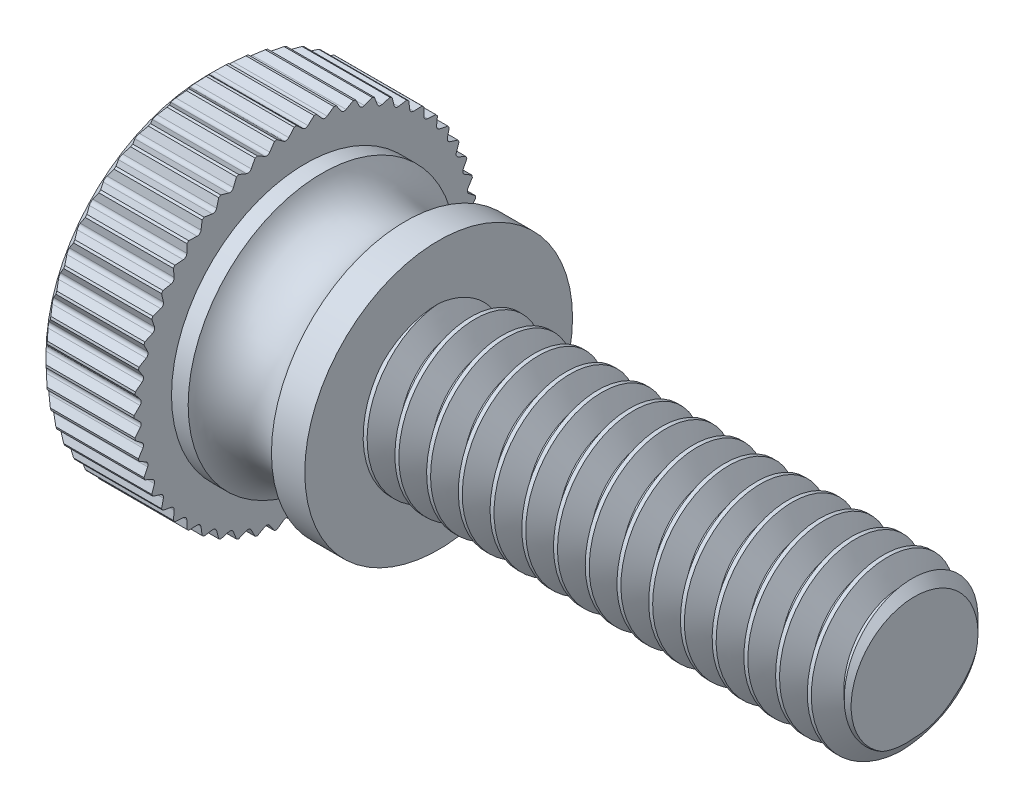
from build123d import *

# Parameters (mm, degrees)
CHAMFER1_SIZE      = 0.635
CHAMFER2_SIZE      = 0.41148
CUT_SWEEP1_PITCH   = 1.27
CUT_SWEEP1_TO      = 19.05
CUT_EXTRUDE1_DEPTH = 9.271
CIRPATTERN1_COUNT  = 54


with BuildPart() as part:
    # Sketch3 → Revolve1 (revolve)
    with BuildSketch(Plane.XY, mode=Mode.PRIVATE) as revolve1_sk:
        with BuildLine():
            Line((-9.271, 0), (-9.271, 6.858))
            Line((-9.271, 6.858), (-5.334, 6.858))
            Line((-5.334, 6.858), (-5.334, 5.3594))
            Line((-5.334, 5.3594), (-4.66725, 5.3594))
            ThreePointArc((-4.66725, 5.3594), (-3.000375, 4.28752), (-1.3335, 5.3594))
            Line((-1.3335, 5.3594), (0, 5.3594))
            Line((0, 5.3594), (0, 3.175))
            Line((0, 3.175), (19.05, 3.175))
            Line((19.05, 3.175), (19.05, 0))
            Line((19.05, 0), (-9.271, 0))
        make_face()
    revolve(revolve1_sk.sketch.rotate(Axis((0, 0, 0), (1, 0, 0)), 90), axis=Axis((0, 0, 0), (1, 0, 0)))

    # Chamfer1
    chamfer1_edges = [part.edges().sort_by_distance(p)[0] for p in [
        (19.05, 0, -3.175),
    ]]
    chamfer(chamfer1_edges, length=CHAMFER1_SIZE)

    # Chamfer2
    chamfer2_edges = [part.edges().sort_by_distance(p)[0] for p in [
        (-9.271, 0, -6.858),
    ]]
    chamfer(chamfer2_edges, length=CHAMFER2_SIZE)


with BuildPart() as body_2:
    # Split1: the piece on the far side of the plane
    add(part.part)
    split(bisect_by=Plane(origin=(0, 0, 0), x_dir=(0, 0, 1), z_dir=(1, 0, 0)), keep=Keep.BOTTOM)


with BuildPart() as part_1:
    add(part.part)

    # Split1
    split(bisect_by=Plane(origin=(0, 0, 0), x_dir=(0, 0, 1), z_dir=(1, 0, 0)), keep=Keep.TOP)

    # Cut-Sweep1: arcs per turn and ends read off the stored shape
    # Cut-Sweep1: the profile of Sketch5 screwed along a right-hand helix through 16 turns, 8 arcs to a turn; built about Z, then put on its axis
    cut_sweep1_z = Axis((0, 0, 0), (0, 0, 1))
    cut_sweep1_corners = [(3.243740766, 0, 0.0396875), (3.243740766, 0, -1.1509375), (2.350110803, 0, -0.635), (2.350110803, 0, -0.47625)]
    with BuildLine(mode=Mode.PRIVATE) as cut_sweep1_profile:
        Line(cut_sweep1_corners[0], cut_sweep1_corners[1])
        Line(cut_sweep1_corners[1], cut_sweep1_corners[2])
        Line(cut_sweep1_corners[2], cut_sweep1_corners[3])
        Line(cut_sweep1_corners[3], cut_sweep1_corners[0])
    cut_sweep1_cap = Face(cut_sweep1_profile.wire())
    cut_sweep1_turn_angles = [0, 22.5, 45, 67.5, 90, 112.5, 135, 157.5, 180, 202.5, 225, 247.5, 270, 292.5, 315, 337.5, 360]
    cut_sweep1_turn_weights = [1, 0.9238795325112867, 1, 0.9238795325112867, 1, 0.9238795325112867, 1, 0.9238795325112867, 1, 0.9238795325112867, 1, 0.9238795325112867, 1, 0.9238795325112867, 1, 0.9238795325112867, 1]
    cut_sweep1_turn_rails = [Edge.make_bspline([Vector(p[0], p[1], 0).rotate(cut_sweep1_z, cut_sweep1_turn_angles[k]) / cut_sweep1_turn_weights[k] + Vector(0, 0, p[2] + CUT_SWEEP1_PITCH * cut_sweep1_turn_angles[k] / 360) for k in range(17)], [0, 0, 0, 1, 1, 2, 2, 3, 3, 4, 4, 5, 5, 6, 6, 7, 7, 8, 8, 8], 2, cut_sweep1_turn_weights) for p in cut_sweep1_corners]
    cut_sweep1_turn_sides = [Face.make_surface_from_curves(cut_sweep1_turn_rails[p[0]], cut_sweep1_turn_rails[p[1]]) for p in [(0, 1), (1, 2), (2, 3), (3, 0)]]
    cut_sweep1 = Plane(origin=(19.05, 0, 0), x_dir=(0, 1, 0), z_dir=(-1, 0, 0)) * split(Solid(Shell([*[p.moved(Location((0, 0, CUT_SWEEP1_PITCH * i))) for i in range(16) for p in cut_sweep1_turn_sides], cut_sweep1_cap, cut_sweep1_cap.rotate(cut_sweep1_z, 5760).moved(Location((0, 0, CUT_SWEEP1_PITCH * 5760 / 360)))])), bisect_by=Plane.XY.offset(CUT_SWEEP1_TO), keep=Keep.BOTTOM, mode=Mode.PRIVATE)
    add(cut_sweep1, mode=Mode.SUBTRACT)

    add(body_2.part)  # Boss-Extrude1 merges body 2
    # Boss-Extrude1 cone 1 section (through the dimple's axis) → Boss-Extrude1 (revolve)
    with BuildSketch(Plane(origin=(0, 0, 0), x_dir=(0, 0, -1), z_dir=(0, 1, 0))):
        Polygon((0, 0), (3.175, 0), (0, 1.833087105), align=None)
    revolve(axis=Axis((0, 0, 0), (-1, 0, 0)))

    # Sketch7 → Cut-Extrude1 (cut)
    with BuildSketch(Plane.ZY.offset(9.271)):
        with BuildLine():
            Line((-0.637405357, 7.112), (0.637405357, 7.112))
            Line((0.637405357, 7.112), (0.10287, 6.623598943))
            ThreePointArc((0.10287, 6.623598943), (0, 6.58368), (-0.10287, 6.623598943))
            Line((-0.10287, 6.623598943), (-0.637405357, 7.112))
        make_face()
    cut_extrude1 = extrude(amount=-CUT_EXTRUDE1_DEPTH, mode=Mode.SUBTRACT)

    # CirPattern1: Cut-Extrude1 ×54 about axis
    cirpattern1_axis = Axis((0, 0, 0), (1, 0, 0))
    for i in range(1, CIRPATTERN1_COUNT):
        add(cut_extrude1.rotate(cirpattern1_axis, i * 360 / CIRPATTERN1_COUNT), mode=Mode.SUBTRACT)


solid = part_1.part
